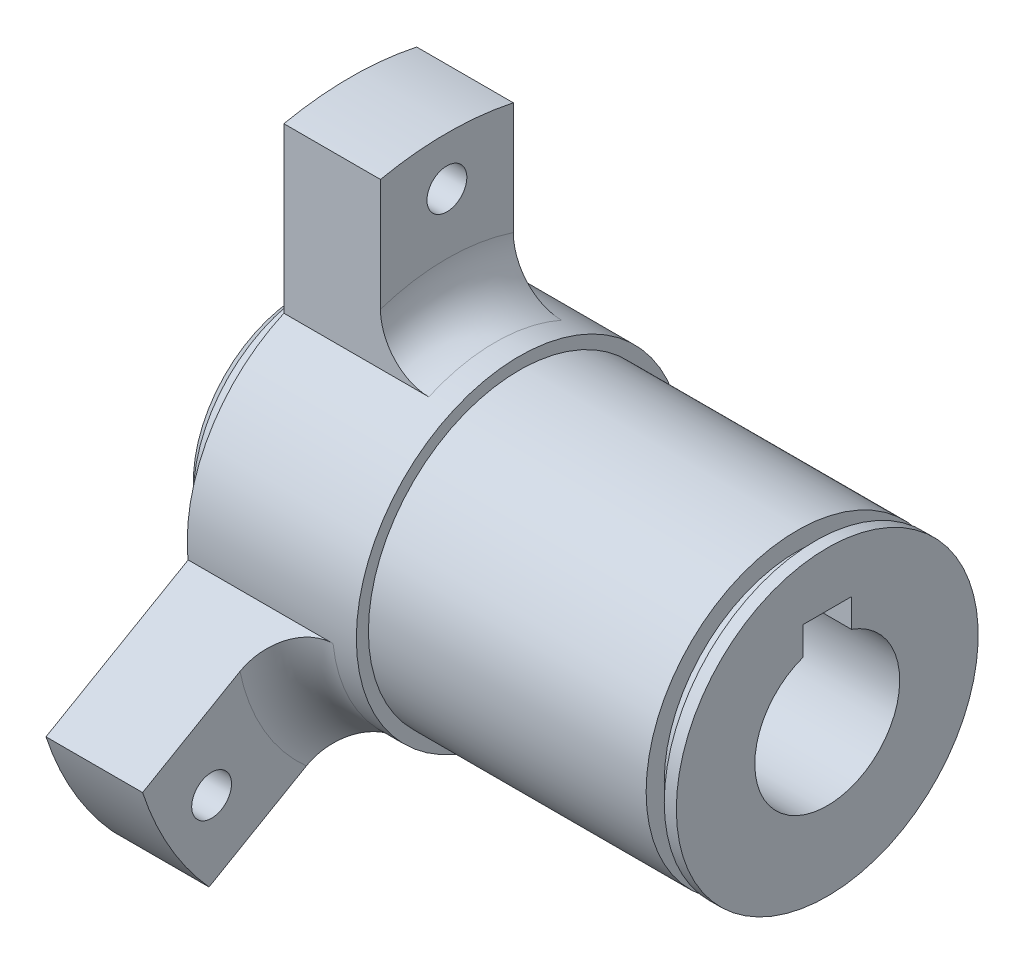
from build123d import *
from build123d.topology import SkipClean

# Parameters (mm, degrees)
CUT_EXTRUDE_662_DEPTH  = 58.417331878
SKETCH_8_W             = 1.5
SKETCH_8_H             = 1.5
HOLE_WIZARD_M4_1_D     = 3.3
HOLE_WIZARD_M4_1_DEPTH = 10.1
HOLE_WIZARD_M4_1_TIP   = 0.991420021
FILLET_1_R             = 4
CUT_EXTRUDE_2_REACH    = 56.45
CHAMFER_1_SIZE         = 1


with BuildPart() as part:
    # 草图2 → 旋转1 (revolve)
    with BuildSketch(Plane.XY):
        Polygon((0, 0), (10, 0), (39.5, 0), (39.5, 12.5), (14, 12.5), (14, 13.5), (8, 13.5), (8, 26.5), (0, 26.5), (0, 10), (-4, 10), (-4, 0), align=None)
    revolve(axis=Axis((0, 0, 0), (1, 0, 0)))

    # 草图3 → Cut-Extrude 662 (cut, through all)
    with BuildSketch(Plane(origin=(39.5, 0, 0), x_dir=(0, 0, -1), z_dir=(1, 0, 0))):
        with BuildLine():
            Line((-2, 5.656854249), (-2, 8))
            Line((-2, 8), (2, 8))
            Line((2, 8), (2, 5.656854249))
            ThreePointArc((2, 5.656854249), (0, -6), (-2, 5.656854249))
        make_face()
    extrude(amount=-CUT_EXTRUDE_662_DEPTH, mode=Mode.SUBTRACT)

    # 草图8 → Cut-Revolve 857 (revolve, cut)
    with BuildSketch(Plane(origin=(0, 0, 0), x_dir=(1, 0, 0), z_dir=(0, 1, 0))):
        with Locations((37.75, 11.75)):
            Rectangle(SKETCH_8_W, SKETCH_8_H)
    revolve(axis=Axis((0, 0, 0), (1, 0, 0)), mode=Mode.SUBTRACT)

    # M4 螺纹孔1
    with Locations(Plane.ZY):
        with Locations((0, 22.5), (19.485571585, -11.25), (-19.485571585, -11.25)):
            Hole(HOLE_WIZARD_M4_1_D / 2, depth=HOLE_WIZARD_M4_1_DEPTH)
            with Locations((0, 0, -(HOLE_WIZARD_M4_1_DEPTH + HOLE_WIZARD_M4_1_TIP / 2))):  # 118° drill point
                Cone(0, HOLE_WIZARD_M4_1_D / 2, HOLE_WIZARD_M4_1_TIP, mode=Mode.SUBTRACT)

    # 圆角1
    fillet_1_edges = [part.edges().sort_by_distance(p)[0] for p in [
        (8, -13.5, 0),
    ]]
    fillet(fillet_1_edges, radius=FILLET_1_R)

    # 草图13 → 切除-拉伸2 (cut, up to next)
    with BuildSketch(Plane.ZY, mode=Mode.PRIVATE) as cut_extrude_2_sk1:
        with BuildLine():
            Line((-5.5, 12.328828006), (-5.5, 25.922962794))
            ThreePointArc((-5.5, 25.922962794), (-22.9496732, 13.25), (-25.199944321, -8.198341676))
            Line((-25.199944321, -8.198341676), (-13.427078252, -1.401274282))
            ThreePointArc((-13.427078252, -1.401274282), (-11.691342951, 6.75), (-5.5, 12.328828006))
        make_face()
    cut_extrude_2_tool1 = extrude(cut_extrude_2_sk1.sketch, amount=-CUT_EXTRUDE_2_REACH, mode=Mode.PRIVATE) & part.part
    # 草图13 → 切除-拉伸2 (cut, up to next)
    with BuildSketch(Plane.ZY, mode=Mode.PRIVATE) as cut_extrude_2_sk2:
        with BuildLine():
            Line((5.5, 12.328828006), (5.5, 25.922962794))
            ThreePointArc((5.5, 25.922962794), (22.9496732, 13.25), (25.199944321, -8.198341676))
            Line((25.199944321, -8.198341676), (13.427078252, -1.401274282))
            ThreePointArc((13.427078252, -1.401274282), (11.691342951, 6.75), (5.5, 12.328828006))
        make_face()
    cut_extrude_2_tool2 = extrude(cut_extrude_2_sk2.sketch, amount=-CUT_EXTRUDE_2_REACH, mode=Mode.PRIVATE) & part.part
    # 草图13 → 切除-拉伸2 (cut, up to next)
    with BuildSketch(Plane.ZY, mode=Mode.PRIVATE) as cut_extrude_2_sk3:
        with BuildLine():
            Line((7.927078252, -10.927553724), (19.699944321, -17.724621118))
            ThreePointArc((19.699944321, -17.724621118), (0, -26.5), (-19.699944321, -17.724621118))
            Line((-19.699944321, -17.724621118), (-7.927078252, -10.927553724))
            ThreePointArc((-7.927078252, -10.927553724), (0, -13.5), (7.927078252, -10.927553724))
        make_face()
    cut_extrude_2_tool3 = extrude(cut_extrude_2_sk3.sketch, amount=-CUT_EXTRUDE_2_REACH, mode=Mode.PRIVATE) & part.part
    add(cut_extrude_2_tool1.solids().sort_by_distance((0, 9.445444, -16.359989))[0], mode=Mode.SUBTRACT)
    add(cut_extrude_2_tool2.solids().sort_by_distance((0, 9.445444, 16.359989))[0], mode=Mode.SUBTRACT)
    add(cut_extrude_2_tool3.solids().sort_by_distance((0, -18.890888, 0))[0], mode=Mode.SUBTRACT)

    # 倒角1
    chamfer_1_edges = [part.edges().sort_by_distance(p)[0] for p in [
        (-4, -10, 0),
    ]]
    chamfer(chamfer_1_edges, length=CHAMFER_1_SIZE)


solid = part.part
